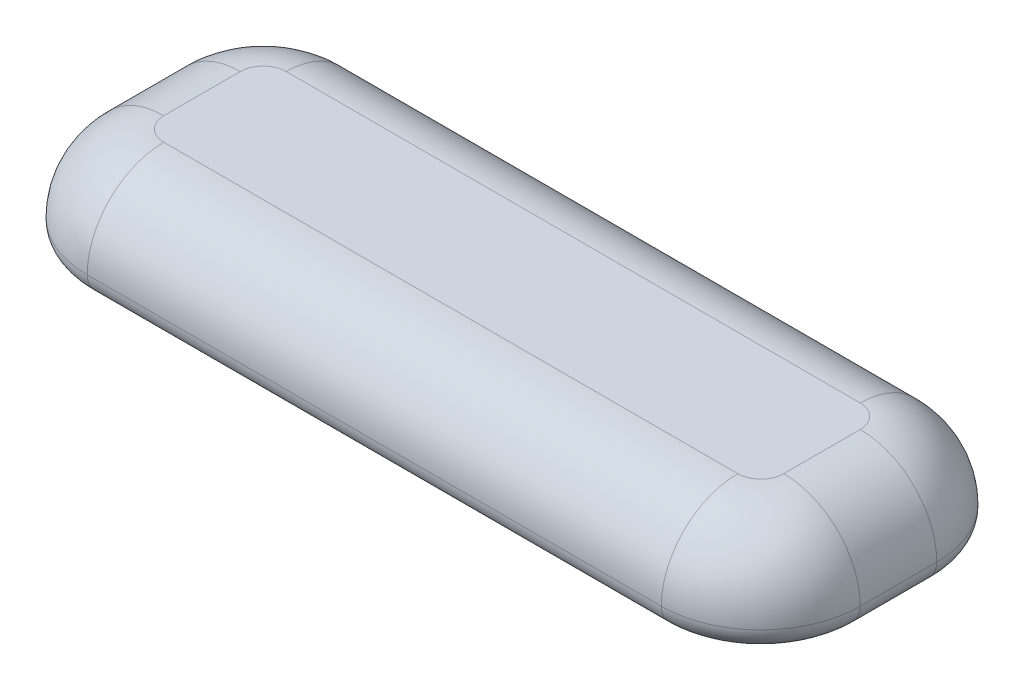
from build123d import *

# Parameters (mm, degrees)
EXTRUDE_1_DEPTH = 10
SHELL_2_T       = 3
FILLET_3_R      = 10
FILLET_4_R      = 3
SKETCH_2_R      = 2.675
EXTRUDE_2_DEPTH = 8
FILLET_7_R      = 5
CHAMFER_1_SIZE  = 0.2
CHAMFER_2_SIZE  = 0.2
FILLET_9_SIZE   = 5.5
FILLET_9_SIZE_2 = 5


# Some blends are built 0.0001 mm under size
with BuildPart() as part:
    # 草图1 → 凸台-拉伸1 (new body)
    with BuildSketch(Plane(origin=(0, 0, 0), x_dir=(1, 0, 0), z_dir=(0, 1, 0))):
        with BuildLine():
            Line((-37.5, 15), (37.5, 15))
            ThreePointArc((37.5, 15), (44.571067812, 12.071067812), (47.5, 5))
            Line((47.5, 5), (47.5, -5))
            ThreePointArc((47.5, -5), (44.571067812, -12.071067812), (37.5, -15))
            Line((37.5, -15), (-37.5, -15))
            ThreePointArc((-37.5, -15), (-44.571067812, -12.071067812), (-47.5, -5))
            Line((-47.5, -5), (-47.5, 5))
            ThreePointArc((-47.5, 5), (-44.571067812, 12.071067812), (-37.5, 15))
        make_face()
    extrude(amount=EXTRUDE_1_DEPTH)

    # 抽壳2
    shell_2_openings = [part.faces().sort_by_distance(p)[0] for p in [
        (0, 0, 0),
    ]]
    offset(amount=SHELL_2_T, openings=shell_2_openings, kind=Kind.INTERSECTION)

    # 圆角3
    # the kernel refuses this fillet: 10 mm, written as the material it takes off along each edge
    with BuildSketch(Plane(origin=(37.5, 13, 5), x_dir=(1, 0, 0), z_dir=(0, 0, -1))) as fillet_3_piece_1:
        with BuildLine():
            CenterArc((13 - FILLET_3_R, FILLET_3_R), FILLET_3_R, 270, 90)
            Line((13 - FILLET_3_R, 0), (13, 0))
            Line((13, 0), (13, FILLET_3_R))
        make_face()
    revolve(axis=Axis((37.5, 13, 5), (0, -1, 0)), revolution_arc=90, mode=Mode.SUBTRACT)
    with BuildSketch(Plane(origin=(50.5, 13, 5), x_dir=(0, -1, 0), z_dir=(0, 0, -1)), Plane(origin=(-50.5, 13, -5), x_dir=(0, -1, 0), z_dir=(0, 0, 1))) as fillet_3_piece_2:
        with BuildLine():
            CenterArc((FILLET_3_R, FILLET_3_R), FILLET_3_R, 180, 90)
            Line((0, FILLET_3_R), (0, 0))
            Line((0, 0), (FILLET_3_R, 0))
        make_face()
    extrude(amount=10, mode=Mode.SUBTRACT)
    with BuildSketch(Plane(origin=(37.5, 13, -5), x_dir=(0, 0, -1), z_dir=(-1, 0, 0))) as fillet_3_piece_3:
        with BuildLine():
            CenterArc((13 - FILLET_3_R, FILLET_3_R), FILLET_3_R, 270, 90)
            Line((13 - FILLET_3_R, 0), (13, 0))
            Line((13, 0), (13, FILLET_3_R))
        make_face()
    revolve(axis=Axis((37.5, 13, -5), (0, -1, 0)), revolution_arc=90, mode=Mode.SUBTRACT)
    with BuildSketch(Plane(origin=(37.5, 13, -18), x_dir=(0, -1, 0), z_dir=(-1, 0, 0)), Plane(origin=(-37.5, 13, 18), x_dir=(0, -1, 0), z_dir=(1, 0, 0))) as fillet_3_piece_4:
        with BuildLine():
            CenterArc((FILLET_3_R, FILLET_3_R), FILLET_3_R, 180, 90)
            Line((0, FILLET_3_R), (0, 0))
            Line((0, 0), (FILLET_3_R, 0))
        make_face()
    extrude(amount=75, mode=Mode.SUBTRACT)
    with BuildSketch(Plane(origin=(-37.5, 13, -5), x_dir=(-1, 0, 0), z_dir=(0, 0, 1))) as fillet_3_piece_5:
        with BuildLine():
            CenterArc((13 - FILLET_3_R, FILLET_3_R), FILLET_3_R, 270, 90)
            Line((13 - FILLET_3_R, 0), (13, 0))
            Line((13, 0), (13, FILLET_3_R))
        make_face()
    revolve(axis=Axis((-37.5, 13, -5), (0, -1, 0)), revolution_arc=90, mode=Mode.SUBTRACT)
    with BuildSketch(Plane(origin=(-37.5, 13, 5), x_dir=(0, 0, 1), z_dir=(1, 0, 0))) as fillet_3_piece_6:
        with BuildLine():
            CenterArc((13 - FILLET_3_R, FILLET_3_R), FILLET_3_R, 270, 90)
            Line((13 - FILLET_3_R, 0), (13, 0))
            Line((13, 0), (13, FILLET_3_R))
        make_face()
    revolve(axis=Axis((-37.5, 13, 5), (0, -1, 0)), revolution_arc=90, mode=Mode.SUBTRACT)

    # 圆角4
    fillet_4_edges = [part.edges().sort_by_distance(p)[0] for p in [
        (50.5, 0, 0),
        (46.692388155, 0, 14.192388155),
        (0, 0, 18),
        (-46.692388155, 0, 14.192388155),
        (-50.5, 0, 0),
        (-46.692388155, 0, -14.192388155),
        (0, 0, -18),
        (46.692388155, 0, -14.192388155),
    ]]
    fillet(fillet_4_edges, radius=FILLET_4_R - 0.0001)  # a hair under: the kernel refuses the full size

    # 草图2 → 凸台-拉伸2 (add)
    # profile 1 of 2: a face of its own
    with BuildSketch(Plane(origin=(0, 10, 0), x_dir=(-1, 0, 0), z_dir=(0, -1, 0))):
        with Locations(Location((36.7, 0, 0), (0, 0, 270))):
            Circle(SKETCH_2_R)
        Polygon((34.625, -0.575), (34.625, 0.575), (36.125, 0.575), (36.125, 2.075), (37.275, 2.075), (37.275, 0.575), (38.775, 0.575), (38.775, -0.575), (37.275, -0.575), (37.275, -2.075), (36.125, -2.075), (36.125, -0.575), align=None, mode=Mode.SUBTRACT)
    # profile 2 of 2: a face of its own
    with BuildSketch(Plane(origin=(0, 10, 0), x_dir=(-1, 0, 0), z_dir=(0, -1, 0))):
        with Locations(Location((-36.7, 0, 0), (0, 0, 90))):
            Circle(SKETCH_2_R)
        Polygon((-37.275, 0.575), (-37.275, 2.075), (-36.125, 2.075), (-36.125, 0.575), (-34.625, 0.575), (-34.625, -0.575), (-36.125, -0.575), (-36.125, -2.075), (-37.275, -2.075), (-37.275, -0.575), (-38.775, -0.575), (-38.775, 0.575), align=None, mode=Mode.SUBTRACT)
    extrude(amount=EXTRUDE_2_DEPTH)

    # 圆角7
    fillet_7_edges = [part.edges().sort_by_distance(p)[0] for p in [
        (-44.571067812, 10, 12.071067812),
        (0, 10, 15),
        (44.571067812, 10, 12.071067812),
        (47.5, 10, 0),
        (44.571067812, 10, -12.071067812),
        (0, 10, -15),
        (-44.571067812, 10, -12.071067812),
        (-47.5, 10, 0),
    ]]
    fillet(fillet_7_edges, radius=FILLET_7_R)

    # 倒角1
    chamfer_1_edges = [part.edges().sort_by_distance(p)[0] for p in [
        (35.375, 2, -0.575),
        (37.275, 2, 1.325),
        (38.775, 2, 0),
        (38.025, 2, -0.575),
        (37.275, 2, -1.325),
        (36.7, 2, -2.075),
        (34.625, 2, 0),
        (35.375, 2, 0.575),
        (36.125, 2, 1.325),
        (36.7, 2, 2.075),
        (38.025, 2, 0.575),
        (36.125, 2, -1.325),
    ]]
    chamfer(chamfer_1_edges, length=CHAMFER_1_SIZE)

    # 倒角2
    chamfer_2_edges = [part.edges().sort_by_distance(p)[0] for p in [
        (-36.7, 2, -2.075),
        (-37.275, 2, -1.325),
        (-38.025, 2, -0.575),
        (-38.775, 2, 0),
        (-37.275, 2, 1.325),
        (-35.375, 2, -0.575),
        (-38.025, 2, 0.575),
        (-36.7, 2, 2.075),
        (-36.125, 2, 1.325),
        (-35.375, 2, 0.575),
        (-34.625, 2, 0),
        (-36.125, 2, -1.325),
    ]]
    chamfer(chamfer_2_edges, length=CHAMFER_2_SIZE)

    # 圆角9
    # a fillet whose section is not a circle: 5.5, 5 mm, written as the material it adds along each edge
    with BuildSketch(Plane(origin=(36.7, 10, 0), x_dir=(0, 0, -1), z_dir=(-1, 0, 0))) as fillet_9_piece_1:
        with BuildLine():
            Bezier((2.675 + FILLET_9_SIZE, 0), (2.675, 0), (2.675, FILLET_9_SIZE_2), weights=[1, 0.333333333, 1])
            Line((2.675, FILLET_9_SIZE_2), (2.675, 0))
            Line((2.675, 0), (2.675 + FILLET_9_SIZE, 0))
        make_face()
    revolve(axis=Axis((36.7, 10, 0), (0, -1, 0)))

    # 圆角10
    # a fillet whose section is not a circle: 5.5, 5 mm, written as the material it adds along each edge (its section moved 0.00015 mm through the faces so that the kernel can cut it)
    with BuildSketch(Plane(origin=(-36.7, 10, 0), x_dir=(0, 0, 1), z_dir=(1, 0, 0))) as fillet_10_piece_1:
        with BuildLine():
            Bezier((7.675, -0.00015), (2.67485, -0.00015), (2.67485, 5.5), weights=[1, 0.333333333, 1])
            Line((2.67485, 5.5), (2.56485, 5.5))
            ThreePointArc((2.56485, 5.5), (2.565, 2.75), (2.565, 0))
            Line((2.565, 0), (2.675, -0.11))
            ThreePointArc((2.675, -0.11), (5.175, -0.11), (7.675, -0.11015))
            Line((7.675, -0.11015), (7.675, -0.00015))
        make_face()
    revolve(axis=Axis((-36.7, 10, 0), (0, -1, 0)))


solid = part.part
